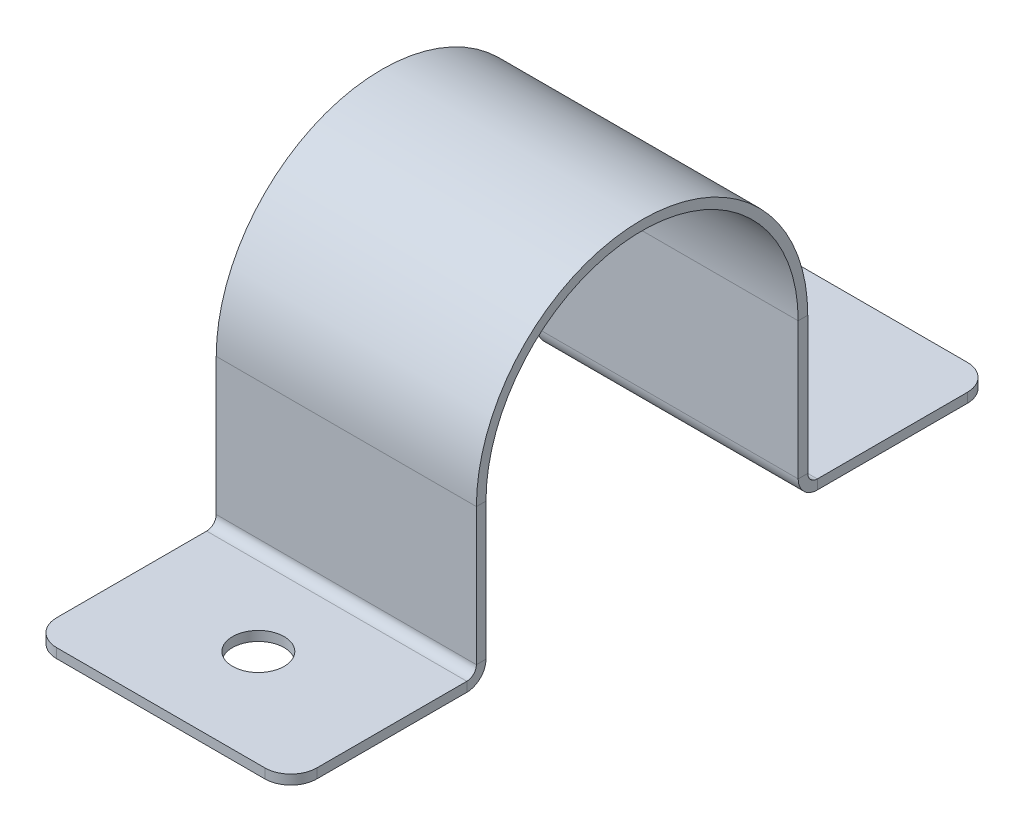
from build123d import *

# Parameters (mm, degrees)
BASE_FLANGE1_DEPTH = 10
SKETCH6_R          = 1.984375
CUT_EXTRUDE1_DEPTH = 38.483329628
FILLET1_R          = 2
FILLET2_R          = 2
FILLET3_R          = 2


# Sheet-metal steps are written as plain solids
with BuildPart() as part:
    # Sketch1 → Base-Flange1 (new, symmetric)
    with BuildSketch(Plane(origin=(0, 0, 0), x_dir=(0, 0, -1), z_dir=(1, 0, 0))):
        with BuildLine():
            Line((-27, 0), (-13.4732, 0))
            ThreePointArc((-13.4732, 0), (-12.43149029, 0.43149029), (-12, 1.4732))
            Line((-12, 1.4732), (-12, 12))
            ThreePointArc((-12, 12), (0, 24), (12, 12))
            Line((12, 12), (12, 1.4732))
            ThreePointArc((12, 1.4732), (12.43149029, 0.43149029), (13.4732, 0))
            Line((13.4732, 0), (27, 0))
            Line((27, 0), (27, 0.7366))
            Line((27, 0.7366), (13.4732, 0.7366))
            ThreePointArc((13.4732, 0.7366), (12.952345145, 0.952345145), (12.7366, 1.4732))
            Line((12.7366, 1.4732), (12.7366, 12))
            ThreePointArc((12.7366, 12), (0, 24.7366), (-12.7366, 12))
            Line((-12.7366, 12), (-12.7366, 1.4732))
            ThreePointArc((-12.7366, 1.4732), (-12.952345145, 0.952345145), (-13.4732, 0.7366))
            Line((-13.4732, 0.7366), (-27, 0.7366))
            Line((-27, 0.7366), (-27, 0))
        make_face()
    extrude(amount=BASE_FLANGE1_DEPTH, both=True)

    # Sketch6 → Cut-Extrude1 (cut, through all)
    with BuildSketch(Plane(origin=(0, 0.7366, 0), x_dir=(1, 0, 0), z_dir=(0, 1, 0))):
        with Locations(Location((0, -19.5, 0), (0, 0, 270))):
            Circle(SKETCH6_R)
    cut_extrude1 = extrude(amount=-CUT_EXTRUDE1_DEPTH, mode=Mode.SUBTRACT)

    # Mirror1: Cut-Extrude1 across plane
    add(cut_extrude1.mirror(Plane.XY), mode=Mode.SUBTRACT)

    # Fillet1
    fillet1_edges = [part.edges().sort_by_distance(p)[0] for p in [
        (10, 0.3683, -27),
    ]]
    fillet(fillet1_edges, radius=FILLET1_R)

    # Fillet2
    fillet2_edges = [part.edges().sort_by_distance(p)[0] for p in [
        (-10, 0.3683, -27),
    ]]
    fillet(fillet2_edges, radius=FILLET2_R)

    # Fillet3
    fillet3_edges = [part.edges().sort_by_distance(p)[0] for p in [
        (-10, 0.3683, 27),
        (10, 0.3683, 27),
    ]]
    fillet(fillet3_edges, radius=FILLET3_R)


solid = part.part
